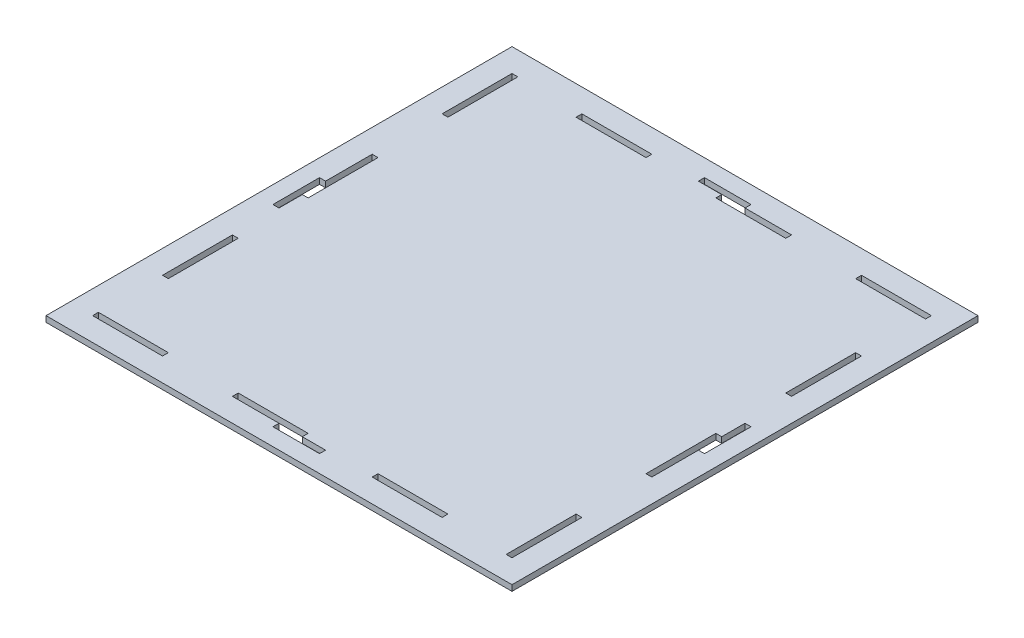
from build123d import *

# Parameters (mm, degrees)
SKETCH1_W           = 254
SKETCH1_H           = 254
SKETCH1_W_2         = 38.1
SKETCH1_H_2         = 3.175
SKETCH1_W_3         = 3.175
SKETCH1_H_3         = 38.1
BOSS_EXTRUDE1_DEPTH = 3.175


with BuildPart() as part:
    # Sketch1 → Boss-Extrude1 (new body)
    with BuildSketch(Plane(origin=(0, 0, 0), x_dir=(1, 0, 0), z_dir=(0, 1, 0))):
        Rectangle(SKETCH1_W, SKETCH1_H)
        with Locations((-57.15, 112.7125)):
            Rectangle(SKETCH1_W_2, SKETCH1_H_2, mode=Mode.SUBTRACT)
        with Locations((-112.7125, 95.25)):
            Rectangle(SKETCH1_W_3, SKETCH1_H_3, mode=Mode.SUBTRACT)
        Polygon((38.1, 111.125), (0, 111.125), (0, 114.3), (-12.7, 114.3), (-12.7, 117.602), (12.7, 117.602), (12.7, 114.3), (38.1, 114.3), align=None, mode=Mode.SUBTRACT)
        with Locations((95.25, 112.7125)):
            Rectangle(SKETCH1_W_2, SKETCH1_H_2, mode=Mode.SUBTRACT)
        with Locations((112.7125, 57.15)):
            Rectangle(SKETCH1_W_3, SKETCH1_H_3, mode=Mode.SUBTRACT)
        Polygon((111.125, -38.1), (111.125, 0), (114.3, 0), (114.3, 12.7), (117.602, 12.7), (117.602, -12.7), (114.3, -12.7), (114.3, -38.1), align=None, mode=Mode.SUBTRACT)
        with Locations((112.7125, -95.25)):
            Rectangle(SKETCH1_W_3, SKETCH1_H_3, mode=Mode.SUBTRACT)
        with Locations((57.15, -112.7125)):
            Rectangle(SKETCH1_W_2, SKETCH1_H_2, mode=Mode.SUBTRACT)
        Polygon((-38.1, -111.125), (0, -111.125), (0, -114.3), (12.7, -114.3), (12.7, -117.602), (-12.7, -117.602), (-12.7, -114.3), (-38.1, -114.3), align=None, mode=Mode.SUBTRACT)
        with Locations((-95.25, -112.7125)):
            Rectangle(SKETCH1_W_2, SKETCH1_H_2, mode=Mode.SUBTRACT)
        with Locations((-112.7125, -57.15)):
            Rectangle(SKETCH1_W_3, SKETCH1_H_3, mode=Mode.SUBTRACT)
        Polygon((-111.125, 38.1), (-111.125, 0), (-114.3, 0), (-114.3, -12.7), (-117.602, -12.7), (-117.602, 12.7), (-114.3, 12.7), (-114.3, 38.1), align=None, mode=Mode.SUBTRACT)
    extrude(amount=BOSS_EXTRUDE1_DEPTH)


solid = part.part
